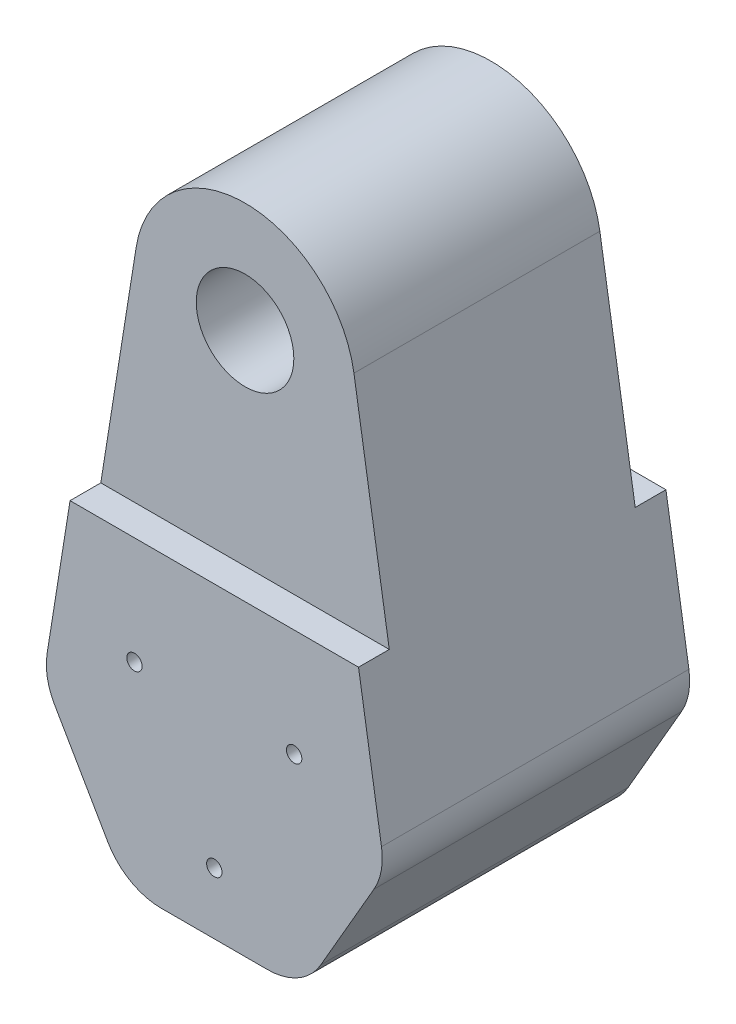
from build123d import *

# Parameters (mm, degrees)
SKETCH1_R           = 1.25
BOSS_EXTRUDE1_DEPTH = 25
SKETCH1_3_R         = 7.9375
BOSS_EXTRUDE2_DEPTH = 20


with BuildPart() as part:
    # Sketch1 → Boss-Extrude1 (new, symmetric)
    with BuildSketch(Plane.XY):
        with BuildLine():
            Line((23.460328237, -33.213203436), (-23.460328237, -33.213203436))
            Line((-23.460328237, -33.213203436), (-27.195743689, -56.638490264))
            ThreePointArc((-27.195743689, -56.638490264), (-27.154012409, -60.03039702), (-25.980762114, -63.213203436))
            Line((-25.980762114, -63.213203436), (-17.320508076, -78.213203436))
            ThreePointArc((-17.320508076, -78.213203436), (-13.660254038, -81.873457473), (-8.660254038, -83.213203436))
            Line((-8.660254038, -83.213203436), (8.660254038, -83.213203436))
            ThreePointArc((8.660254038, -83.213203436), (13.660254038, -81.873457473), (17.320508076, -78.213203436))
            Line((17.320508076, -78.213203436), (25.980762114, -63.213203436))
            ThreePointArc((25.980762114, -63.213203436), (27.154012409, -60.03039702), (27.195743689, -56.638490264))
            Line((27.195743689, -56.638490264), (23.460328237, -33.213203436))
        make_face()
        with Locations((-12.990381057, -50.713203436)):
            Circle(SKETCH1_R, mode=Mode.SUBTRACT)
        with Locations((0, -73.213203436)):
            Circle(SKETCH1_R, mode=Mode.SUBTRACT)
        with Locations((12.990381057, -50.713203436)):
            Circle(SKETCH1_R, mode=Mode.SUBTRACT)
    extrude(amount=BOSS_EXTRUDE1_DEPTH, both=True)

    # Sketch1<3> → Boss-Extrude2 (add, symmetric)
    with BuildSketch(Plane.XY):
        with BuildLine():
            ThreePointArc((17.713703882, 2.824641751), (0, 17.9375), (-17.713703882, 2.824641751))
            Line((-17.713703882, 2.824641751), (-23.460328237, -33.213203436))
            Line((-23.460328237, -33.213203436), (23.460328237, -33.213203436))
            Line((23.460328237, -33.213203436), (17.713703882, 2.824641751))
        make_face()
        Circle(SKETCH1_3_R, mode=Mode.SUBTRACT)
    extrude(amount=BOSS_EXTRUDE2_DEPTH, both=True)


solid = part.part
